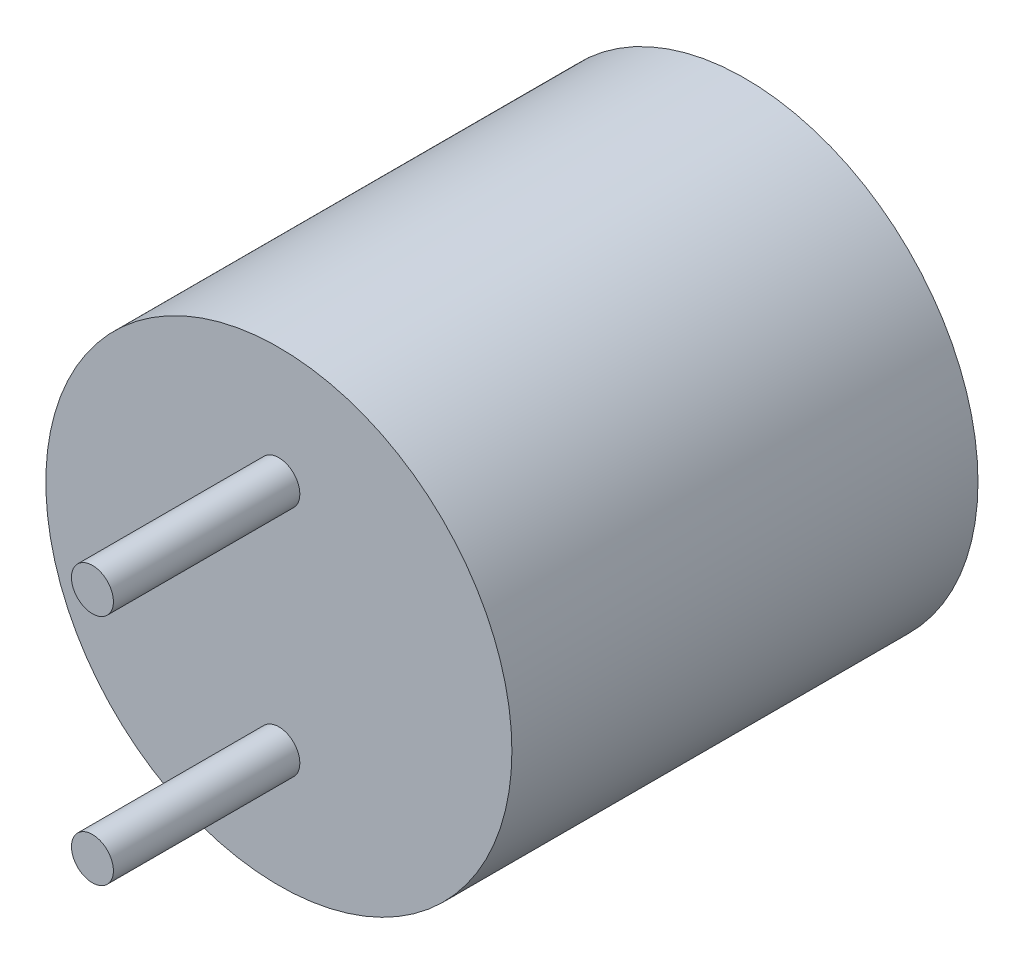
from build123d import *
from build123d.topology import SkipClean

# Parameters (mm, degrees)
SKETCH1_R           = 5
BOSS_EXTRUDE1_DEPTH = 10
SKETCH2_R           = 0.45
BOSS_EXTRUDE2_DEPTH = 4
SHELL1_START        = 0.5
SHELL1_OUTLINE_R    = 4.5
SHELL1_DEPTH        = 8.5
SKETCH4_R           = 1
CUT_EXTRUDE2_DEPTH  = 4
SKETCH5_R           = 4
BOSS_EXTRUDE3_DEPTH = 7


# Read off the part's stored shape, not the designer's step: Shell1
with BuildPart() as part:
    # Sketch1 → Boss-Extrude1 (new body)
    with BuildSketch(Plane.XY):
        Circle(SKETCH1_R)
    extrude(amount=BOSS_EXTRUDE1_DEPTH)

    # Sketch2 → Boss-Extrude2 (add)
    with BuildSketch(Plane.XY.offset(10)):
        with Locations((0, 2.5)):
            Circle(SKETCH2_R)
        with Locations((0, -2.5)):
            Circle(SKETCH2_R)
    extrude(amount=BOSS_EXTRUDE2_DEPTH)

    # Shell1 outline → Shell1 (cut)
    with BuildSketch(Plane.XY.offset(SHELL1_START)):
        Circle(SHELL1_OUTLINE_R)
    extrude(amount=SHELL1_DEPTH, mode=Mode.SUBTRACT)

    # Sketch4 → Cut-Extrude2 (cut)
    with SkipClean():  # the faces are left unmerged after this step: merging them gives an invalid solid
        with BuildSketch(Plane(origin=(0, 0, 0), x_dir=(-1, 0, 0), z_dir=(0, 0, -1))):
            with BuildLine():
                ThreePointArc((-2.75, 2.165063509), (-1.75, 3.031088913), (-0.5, 3.464101615))
                Line((-0.5, 3.464101615), (-0.5, 4.472135955))
                ThreePointArc((-0.5, 4.472135955), (-2.25, 3.897114317), (-3.622983346, 2.669080679))
                Line((-3.622983346, 2.669080679), (-2.75, 2.165063509))
            make_face()
            with BuildLine():
                ThreePointArc((0.5, 3.464101615), (1.75, 3.031088913), (2.75, 2.165063509))
                Line((2.75, 2.165063509), (3.622983346, 2.669080679))
                ThreePointArc((3.622983346, 2.669080679), (2.25, 3.897114317), (0.5, 4.472135955))
                Line((0.5, 4.472135955), (0.5, 3.464101615))
            make_face()
            with BuildLine():
                ThreePointArc((0.5, 1.677050983), (0.875, 1.515544457), (1.202368755, 1.271538193))
                Line((1.202368755, 1.271538193), (2.091874249, 1.78509443))
                ThreePointArc((2.091874249, 1.78509443), (1.375, 2.38156986), (0.5, 2.704163457))
                Line((0.5, 2.704163457), (0.5, 1.677050983))
            make_face()
            with BuildLine():
                ThreePointArc((-1.202368755, 1.271538193), (-0.875, 1.515544457), (-0.5, 1.677050983))
                Line((-0.5, 1.677050983), (-0.5, 2.704163457))
                ThreePointArc((-0.5, 2.704163457), (-1.375, 2.38156986), (-2.091874249, 1.78509443))
                Line((-2.091874249, 1.78509443), (-1.202368755, 1.271538193))
            make_face()
            Circle(SKETCH4_R)
            with BuildLine():
                ThreePointArc((-1.702368755, -0.40551279), (-1.75, 0), (-1.702368755, 0.40551279))
                Line((-1.702368755, 0.40551279), (-2.591874249, 0.919069026))
                ThreePointArc((-2.591874249, 0.919069026), (-2.75, 0), (-2.591874249, -0.919069026))
                Line((-2.591874249, -0.919069026), (-1.702368755, -0.40551279))
            make_face()
            with BuildLine():
                Line((-0.5, -2.704163457), (-0.5, -1.677050983))
                ThreePointArc((-0.5, -1.677050983), (-0.875, -1.515544457), (-1.202368755, -1.271538193))
                Line((-1.202368755, -1.271538193), (-2.091874249, -1.78509443))
                ThreePointArc((-2.091874249, -1.78509443), (-1.375, -2.38156986), (-0.5, -2.704163457))
            make_face()
            with BuildLine():
                Line((2.091874249, -1.78509443), (1.202368755, -1.271538193))
                ThreePointArc((1.202368755, -1.271538193), (0.875, -1.515544457), (0.5, -1.677050983))
                Line((0.5, -1.677050983), (0.5, -2.704163457))
                ThreePointArc((0.5, -2.704163457), (1.375, -2.38156986), (2.091874249, -1.78509443))
            make_face()
            with BuildLine():
                Line((2.591874249, 0.919069026), (1.702368755, 0.40551279))
                ThreePointArc((1.702368755, 0.40551279), (1.738051398, 0.204150287), (1.75, 0))
                ThreePointArc((1.75, 0), (1.738051398, -0.204150287), (1.702368755, -0.40551279))
                Line((1.702368755, -0.40551279), (2.591874249, -0.919069026))
                ThreePointArc((2.591874249, -0.919069026), (2.710180269, -0.466286293), (2.75, 0))
                ThreePointArc((2.75, 0), (2.710180269, 0.466286293), (2.591874249, 0.919069026))
            make_face()
            with BuildLine():
                Line((2.591874249, -0.919069026), (1.702368755, -0.40551279))
                ThreePointArc((1.702368755, -0.40551279), (1.515544457, -0.875), (1.202368755, -1.271538193))
                Line((1.202368755, -1.271538193), (2.091874249, -1.78509443))
                ThreePointArc((2.091874249, -1.78509443), (2.38156986, -1.375), (2.591874249, -0.919069026))
            make_face()
            with BuildLine():
                ThreePointArc((-1.202368755, -1.271538193), (-1.515544457, -0.875), (-1.702368755, -0.40551279))
                Line((-1.702368755, -0.40551279), (-2.591874249, -0.919069026))
                ThreePointArc((-2.591874249, -0.919069026), (-2.38156986, -1.375), (-2.091874249, -1.78509443))
                Line((-2.091874249, -1.78509443), (-1.202368755, -1.271538193))
            make_face()
            with BuildLine():
                ThreePointArc((-0.5, 1.677050983), (0, 1.75), (0.5, 1.677050983))
                Line((0.5, 1.677050983), (0.5, 2.704163457))
                ThreePointArc((0.5, 2.704163457), (0, 2.75), (-0.5, 2.704163457))
                Line((-0.5, 2.704163457), (-0.5, 1.677050983))
            make_face()
            with BuildLine():
                Line((4.122983346, 1.803055276), (3.25, 1.299038106))
                ThreePointArc((3.25, 1.299038106), (3.436931771, 0.661437828), (3.5, 0))
                ThreePointArc((3.5, 0), (3.436931771, -0.661437828), (3.25, -1.299038106))
                Line((3.25, -1.299038106), (4.122983346, -1.803055276))
                ThreePointArc((4.122983346, -1.803055276), (4.40473751, -0.921025228), (4.5, 0))
                ThreePointArc((4.5, 0), (4.40473751, 0.921025228), (4.122983346, 1.803055276))
            make_face()
            with BuildLine():
                Line((3.622983346, -2.669080679), (2.75, -2.165063509))
                ThreePointArc((2.75, -2.165063509), (1.75, -3.031088913), (0.5, -3.464101615))
                Line((0.5, -3.464101615), (0.5, -4.472135955))
                ThreePointArc((0.5, -4.472135955), (2.25, -3.897114317), (3.622983346, -2.669080679))
            make_face()
            with BuildLine():
                Line((-0.5, -4.472135955), (-0.5, -3.464101615))
                ThreePointArc((-0.5, -3.464101615), (-1.75, -3.031088913), (-2.75, -2.165063509))
                Line((-2.75, -2.165063509), (-3.622983346, -2.669080679))
                ThreePointArc((-3.622983346, -2.669080679), (-2.25, -3.897114317), (-0.5, -4.472135955))
            make_face()
            with BuildLine():
                ThreePointArc((-3.25, -1.299038106), (-3.5, 0), (-3.25, 1.299038106))
                Line((-3.25, 1.299038106), (-4.122983346, 1.803055276))
                ThreePointArc((-4.122983346, 1.803055276), (-4.5, 0), (-4.122983346, -1.803055276))
                Line((-4.122983346, -1.803055276), (-3.25, -1.299038106))
            make_face()
        extrude(amount=-CUT_EXTRUDE2_DEPTH, mode=Mode.SUBTRACT)

    # Sketch5 → Boss-Extrude3 (add)
    with SkipClean():  # the faces are left unmerged after this step: merging them gives an invalid solid
        with BuildSketch(Plane(origin=(0, 0, 9), x_dir=(-1, 0, 0), z_dir=(0, 0, -1))):
            with Locations(Location((0, 0, 0), (0, 0, 180))):
                Circle(SKETCH5_R)
        extrude(amount=BOSS_EXTRUDE3_DEPTH)


solid = part.part
